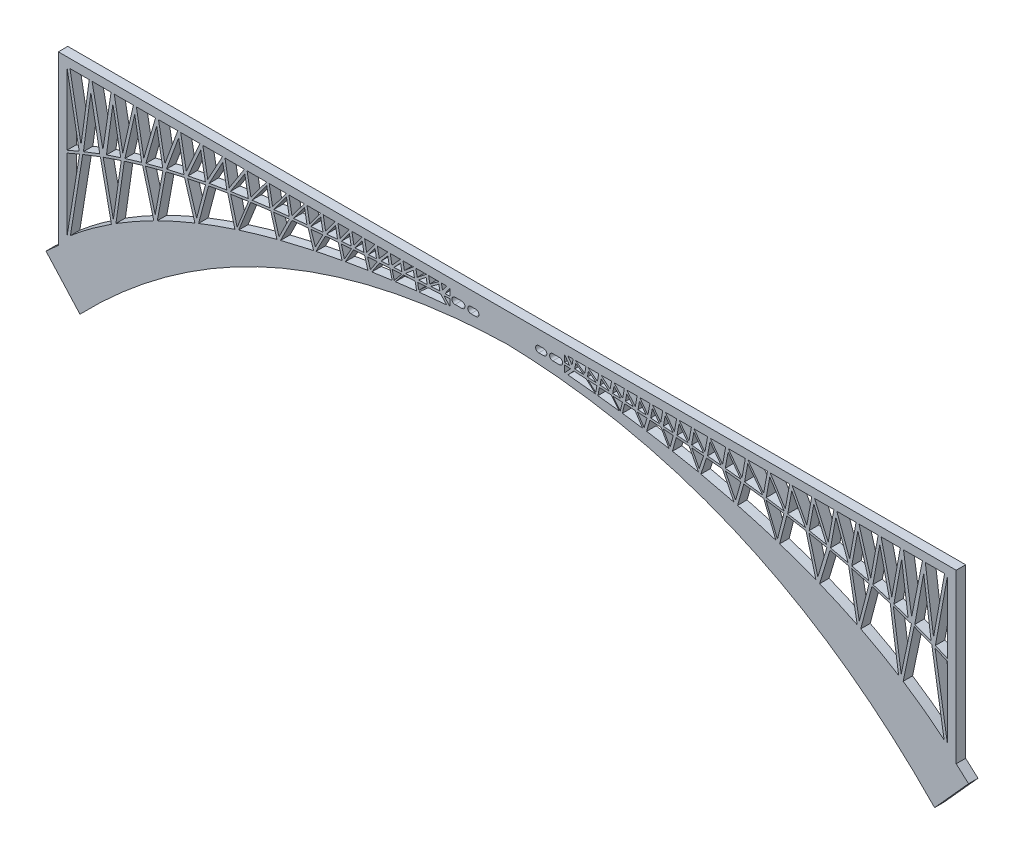
from build123d import *

# Parameters (mm, degrees)
BOSS_EXTRU_1_DEPTH = 820
EXTRU_MINCE6_DEPTH = 820
BOSS_EXTRU_5_DEPTH = 820
BOSS_EXTRU_6_DEPTH = 820


# Read off the part's stored shape, not the designer's step: Extru.-Mince6
with BuildPart() as part:
    # Esquisse2 → Boss.-Extru.1 (new body)
    with BuildSketch(Plane.XY):
        with BuildLine():
            Line((-2.244606432, 13536.155138814), (-2.244606432, 11036.761294931))
            add(Edge.make_bspline(
                [(-37058.069938453, -5233.682093287), (-21887.91411733, 10492.361507123), (-2.244606432, 11036.761294931)],
                knots=[0, 0, 0, 1, 1, 1], degree=2))
            Line((-37058.069938453, -5233.682093287), (-40002.244606432, -1963.844861186))
            Line((-40002.244606432, -1963.844861186), (-38933.428003793, -1001.478069557))
            Line((-38933.428003793, -1001.478069557), (-38933.428003793, 13536.155138814))
            Line((-38933.428003793, 13536.155138814), (-2.244606432, 13536.155138814))
        make_face()
        with BuildLine():
            Line((-3157.812321068, 12302.68810111), (-2729.886154084, 12302.68810111))
            ThreePointArc((-2729.886154084, 12302.68810111), (-2457.297461199, 12030.099408225), (-2729.886154084, 11757.51071534))
            Line((-2729.886154084, 11757.51071534), (-3157.812321068, 11757.51071534))
            ThreePointArc((-3157.812321068, 11757.51071534), (-3430.401013953, 12030.099408225), (-3157.812321068, 12302.68810111))
        make_face(mode=Mode.SUBTRACT)
        with BuildLine():
            Line((-38183.428003793, 12786.155138814), (-4973.994358675, 12786.155138814))
            Line((-4973.994358675, 12786.155138814), (-4973.994358675, 11392.620292854))
            add(Edge.make_bspline(
                [(-4973.994358675, 11392.620292854), (-27306.006645138, 9475.029384523), (-38183.428003793, 0)],
                knots=[0, 0, 0, 1, 1, 1], degree=2))
            Line((-38183.428003793, 0), (-38183.428003793, 12786.155138814))
        make_face(mode=Mode.SUBTRACT)
        with BuildLine():
            Line((-4531.089851617, 12308.04114701), (-3946.776748541, 12308.04114701))
            ThreePointArc((-3946.776748541, 12308.04114701), (-3674.188055656, 12035.452454125), (-3946.776748541, 11762.863761239))
            Line((-3946.776748541, 11762.863761239), (-4531.089851617, 11762.863761239))
            ThreePointArc((-4531.089851617, 11762.863761239), (-4803.678544502, 12035.452454125), (-4531.089851617, 12308.04114701))
        make_face(mode=Mode.SUBTRACT)
    boss_extru_1 = extrude(amount=BOSS_EXTRU_1_DEPTH)

    # Extru.-Mince6 outline → Extru.-Mince6 (add)
    with BuildSketch(Plane.XY):
        with BuildLine():
            Line((-38183.428003793, 6522.511007148), (-38183.428003793, 6303.687196078))
            add(Edge.make_bspline(
                [(-38183.428003793, 6303.687196078), (-36967.661290404, 6844.884291577), (-35735.73188448, 7327.922569493), (-33141.981932269, 8227.751320372), (-31777.813856111, 8635.820478019), (-29023.663743539, 9351.092754748), (-27633.682159885, 9658.295271708), (-24834.23490444, 10190.212405104), (-23424.769754989, 10414.926745323), (-20592.712288631, 10800.259892109), (-19170.120396715, 10960.878633716), (-16318.178696015, 11236.431807199), (-14888.829174365, 11351.366262412), (-12029.74303134, 11553.981118416), (-10600.006574738, 11641.661547035), (-7769.602111438, 11806.86885317), (-6368.838193705, 11884.537074265), (-4973.994358675, 11966.735610338)],
                knots=[0.009502629, 0.009502629, 0.009502629, 0.009502629, 0.125, 0.125, 0.25, 0.25, 0.375, 0.375, 0.5, 0.5, 0.625, 0.625, 0.75, 0.75, 0.875, 0.875, 0.997977053, 0.997977053, 0.997977053, 0.997977053], degree=3))
            Line((-4973.994358675, 11966.735610338), (-4973.994358675, 12167.082703864))
            add(Edge.make_bspline(
                [(-38183.428003793, 6522.511007148), (-36988.607694292, 7051.538460175), (-35778.550369124, 7524.761528352), (-33202.096604982, 8418.589852207), (-31832.809457573, 8828.172458673), (-29069.21545299, 9545.897380996), (-27674.908143053, 9854.040298977), (-24867.676181204, 10387.436588198), (-23454.75100695, 10612.690235655), (-20616.658635699, 10998.844498862), (-19191.49101371, 11159.745179573), (-16335.276736308, 11435.711167269), (-14904.229793763, 11550.77645092), (-12042.618298018, 11753.570271094), (-10612.053580046, 11841.29877979), (-7776.920203959, 12006.78210688), (-6372.260212679, 12084.654958353), (-4973.994358675, 12167.082703864)],
                knots=[0.012065964, 0.012065964, 0.012065964, 0.012065964, 0.125, 0.125, 0.25, 0.25, 0.375, 0.375, 0.5, 0.5, 0.625, 0.625, 0.75, 0.75, 0.875, 0.875, 0.998322947, 0.998322947, 0.998322947, 0.998322947], degree=3))
        make_face()
    extru_mince6 = extrude(amount=EXTRU_MINCE6_DEPTH)

    # Esquisse6 → Boss.-Extru.5 (add)
    with BuildSketch(Plane.XY):
        with BuildLine():
            Line((-38183.428003793, 12786.155138814), (-38183.428003793, 12769.353685746))
            Line((-38183.428003793, 12769.353685746), (-37124.884102272, 6975.155674113))
            add(Edge.make_bspline(
                [(-37124.884102273, 6975.155674113), (-37003.282697839, 7025.346972454), (-36881.532952347, 7074.989155189), (-36759.637336028, 7124.089268105)],
                knots=[0.045294286, 0.045294286, 0.045294286, 0.045294286, 0.056704367, 0.056704367, 0.056704367, 0.056704367], degree=3))
            Line((-36759.637336028, 7124.089268105), (-36111.785997958, 11893.91340386))
            Line((-36111.785997958, 11893.91340386), (-35340.019595981, 7669.46192352))
            add(Edge.make_bspline(
                [(-35340.019595981, 7669.46192352), (-35147.217184046, 7740.031774897), (-34954.079740368, 7809.336350258), (-34760.616782085, 7877.402795117)],
                knots=[0.100799494, 0.100799494, 0.100799494, 0.100799494, 0.118686798, 0.118686798, 0.118686798, 0.118686798], degree=3))
            Line((-34760.616782085, 7877.402795117), (-34201.612185023, 11993.090241262))
            Line((-34201.612185023, 11993.090241262), (-33525.805714906, 8293.898833351))
            add(Edge.make_bspline(
                [(-33525.805714906, 8293.898833351), (-33403.767211736, 8333.328522836), (-33281.608819445, 8372.294894123), (-33159.332859893, 8410.804629723)],
                knots=[0.156610574, 0.156610574, 0.156610574, 0.156610574, 0.167816591, 0.167816591, 0.167816591, 0.167816591], degree=3))
            Line((-33159.332859893, 8410.804629724), (-32309.105384442, 12143.580968361))
            Line((-32309.105384442, 12143.580968361), (-31706.618751713, 8845.723558405))
            add(Edge.make_bspline(
                [(-31706.618751714, 8845.723558405), (-31586.43177328, 8879.886668195), (-31466.141572032, 8913.640081574), (-31345.750305313, 8946.99000756)],
                knots=[0.212031349, 0.212031349, 0.212031349, 0.212031349, 0.222966187, 0.222966187, 0.222966187, 0.222966187], degree=3))
            Line((-31345.750305313, 8946.99000756), (-30404.290511945, 12226.700464355))
            Line((-30404.290511945, 12226.700464355), (-29875.705651478, 9333.362414706))
            add(Edge.make_bspline(
                [(-29875.705651478, 9333.362414706), (-29770.372765024, 9359.595204046), (-29664.970106269, 9385.542151297), (-29559.499082953, 9411.207334525)],
                knots=[0.267326298, 0.267326298, 0.267326298, 0.267326298, 0.276831479, 0.276831479, 0.276831479, 0.276831479], degree=3))
            Line((-29559.499082953, 9411.207334525), (-28497.312055493, 12297.977056308))
            Line((-28497.312055493, 12297.977056308), (-28034.053112546, 9762.2163361))
            add(Edge.make_bspline(
                [(-28034.053112545, 9762.2163361), (-27919.212465415, 9787.167055289), (-27804.299647192, 9811.810613355), (-27689.316443199, 9836.152182171)],
                knots=[0.322518869, 0.322518869, 0.322518869, 0.322518869, 0.332807515, 0.332807515, 0.332807515, 0.332807515], degree=3))
            Line((-27689.316443199, 9836.152182171), (-26585.753726838, 12344.184601649))
            Line((-26585.753726838, 12344.184601649), (-26182.619218078, 10137.529624259))
            add(Edge.make_bspline(
                [(-26182.619218079, 10137.529624259), (-26072.882605514, 10158.238561272), (-25963.089533864, 10178.695509045), (-25853.241525393, 10198.904892772)],
                knots=[0.37763191, 0.37763191, 0.37763191, 0.37763191, 0.387401862, 0.387401862, 0.387401862, 0.387401862], degree=3))
            Line((-25853.241525393, 10198.904892773), (-24670.759235677, 12371.583474121))
            Line((-24670.759235677, 12371.583474121), (-24322.337888694, 10464.414321285))
            add(Edge.make_bspline(
                [(-24322.337888694, 10464.414321285), (-24218.422630744, 10481.377484754), (-24114.46489372, 10498.139210992), (-24010.465949694, 10514.703197883)],
                knots=[0.432687891, 0.432687891, 0.432687891, 0.432687891, 0.441890255, 0.441890255, 0.441890255, 0.441890255], degree=3))
            Line((-24010.465949694, 10514.703197883), (-22765.826798735, 12454.059452474))
            Line((-22765.826798735, 12454.059452474), (-22454.122547538, 10747.870271364))
            add(Edge.make_bspline(
                [(-22454.122547538, 10747.870271364), (-22350.308156095, 10762.477570207), (-22246.459266731, 10776.907472055), (-22142.577131031, 10791.16361524)],
                knots=[0.48770893, 0.48770893, 0.48770893, 0.48770893, 0.496861626, 0.496861626, 0.496861626, 0.496861626], degree=3))
            Line((-22142.577131031, 10791.16361524), (-20858.994414908, 12523.059372165))
            Line((-20858.994414908, 12523.059372165), (-20579.420140887, 10992.741451188))
            add(Edge.make_bspline(
                [(-20579.420140887, 10992.741451188), (-20471.14211549, 11005.843736862), (-20362.834935174, 11018.778003082), (-20254.500002192, 11031.548330129)],
                knots=[0.54270088, 0.54270088, 0.54270088, 0.54270088, 0.552213257, 0.552213257, 0.552213257, 0.552213257], degree=3))
            Line((-20254.500002192, 11031.548330129), (-19150.113829921, 12521.660110022))
            Line((-19150.113829921, 12521.660110022), (-18905.416978224, 11182.252259748))
            add(Edge.make_bspline(
                [(-18905.416978225, 11182.252259748), (-18788.133734029, 11194.657789704), (-18670.824875933, 11206.89166436), (-18553.492173039, 11218.959031455)],
                knots=[0.591659807, 0.591659807, 0.591659807, 0.591659807, 0.601938342, 0.601938342, 0.601938342, 0.601938342], degree=3))
            Line((-18553.492173039, 11218.959031455), (-17584.456839407, 12526.44639596))
            Line((-17584.456839407, 12526.44639596), (-17366.873399692, 11335.450413699))
            add(Edge.make_bspline(
                [(-17366.873399693, 11335.450413698), (-17256.475008752, 11345.791564861), (-17146.060820226, 11356.000971813), (-17035.63230202, 11366.082902755)],
                knots=[0.636566519, 0.636566519, 0.636566519, 0.636566519, 0.646226023, 0.646226023, 0.646226023, 0.646226023], degree=3))
            Line((-17035.63230202, 11366.082902755), (-16178.376018441, 12522.750487541))
            Line((-16178.376018441, 12522.750487541), (-15983.920733348, 11458.352095923))
            add(Edge.make_bspline(
                [(-15983.920733348, 11458.352095923), (-15878.557057037, 11467.234528058), (-15773.184588346, 11476.013383436), (-15667.804599691, 11484.692361836)],
                knots=[0.676880192, 0.676880192, 0.676880192, 0.676880192, 0.686090307, 0.686090307, 0.686090307, 0.686090307], degree=3))
            Line((-15667.804599691, 11484.692361836), (-14898.046652179, 12523.301332191))
            Line((-14898.046652179, 12523.301332191), (-14722.058554191, 11559.987589639))
            add(Edge.make_bspline(
                [(-14722.058554192, 11559.987589639), (-14609.957693259, 11568.616978468), (-14497.852631979, 11577.14593094), (-14385.744900614, 11585.578896572)],
                knots=[0.713637867, 0.713637867, 0.713637867, 0.713637867, 0.723432257, 0.723432257, 0.723432257, 0.723432257], degree=3))
            Line((-14385.744900614, 11585.578896571), (-13694.156977021, 12518.715635922))
            Line((-13694.156977021, 12518.715635922), (-13535.048705507, 11647.797737177))
            add(Edge.make_bspline(
                [(-13535.048705508, 11647.797737176), (-13514.507108864, 11649.259113915), (-13493.965552521, 11650.717646069), (-13386.086166495, 11658.362734454), (-13298.749185179, 11664.501179311), (-13211.413825984, 11670.590797199)],
                knots=[0.748205425, 0.748205425, 0.748205425, 0.748205425, 0.75, 0.75, 0.757630131, 0.757630131, 0.757630131, 0.757630131], degree=3))
            Line((-13211.413825984, 11670.590797199), (-12583.894938261, 12517.281302912))
            Line((-12583.894938261, 12517.281302912), (-12438.832148108, 11723.244769272))
            add(Edge.make_bspline(
                [(-12438.832148109, 11723.244769272), (-12306.894845374, 11732.038501328), (-12174.966120643, 11740.734908939), (-12043.048471569, 11749.341241866)],
                knots=[0.780130997, 0.780130997, 0.780130997, 0.780130997, 0.79165991, 0.79165991, 0.79165991, 0.79165991], degree=3))
            Line((-12043.048471569, 11749.341241866), (-11473.894938261, 12517.281302912))
            Line((-11473.894938261, 12517.281302912), (-11341.811325618, 11794.289460394))
            add(Edge.make_bspline(
                [(-11341.811325619, 11794.289460394), (-11209.792660277, 11802.608634719), (-11077.789531789, 11810.850408842), (-10945.804446233, 11819.022056978)],
                knots=[0.812091509, 0.812091509, 0.812091509, 0.812091509, 0.823633371, 0.823633371, 0.823633371, 0.823633371], degree=3))
            Line((-10945.804446233, 11819.022056978), (-10360.891951327, 12500.843722096))
            Line((-10360.891951326, 12500.843722096), (-10244.154809284, 11861.85452634))
            add(Edge.make_bspline(
                [(-10244.154809284, 11861.85452634), (-10109.940453643, 11869.939039855), (-9975.74937428, 11877.964306837), (-9841.584210721, 11885.937988857)],
                knots=[0.844091409, 0.844091409, 0.844091409, 0.844091409, 0.855834608, 0.855834608, 0.855834608, 0.855834608], degree=3))
            Line((-9841.584210721, 11885.937988857), (-9255.320208822, 12525.082868665))
            Line((-9255.320208822, 12525.082868665), (-9146.032078423, 11926.867653456))
            add(Edge.make_bspline(
                [(-9146.032078423, 11926.867653456), (-9039.074121107, 11933.104963231), (-8932.135562487, 11939.317870157), (-8825.217744578, 11945.510260828)],
                knots=[0.876135199, 0.876135199, 0.876135199, 0.876135199, 0.885503815, 0.885503815, 0.885503815, 0.885503815], degree=3))
            Line((-8825.217744578, 11945.510260828), (-8145.60199258, 12526.625280733))
            Line((-8145.60199258, 12526.625280733), (-8047.613731578, 11990.262654446))
            add(Edge.make_bspline(
                [(-8047.613731578, 11990.262654446), (-7938.838290391, 11996.490963245), (-7830.087736535, 12002.70777072), (-7721.363487511, 12008.91718207)],
                knots=[0.908227445, 0.908227445, 0.908227445, 0.908227445, 0.917768518, 0.917768518, 0.917768518, 0.917768518], degree=3))
            Line((-7721.363487511, 12008.91718207), (-7038.961255908, 12545.01302721))
            Line((-7038.961255908, 12545.01302721), (-6949.071655832, 12052.98039514))
            add(Edge.make_bspline(
                [(-6949.071655833, 12052.98039514), (-6846.750421283, 12058.819945895), (-6744.455523066, 12064.661565095), (-6642.188147036, 12070.508687069)],
                knots=[0.940372794, 0.940372794, 0.940372794, 0.940372794, 0.949362935, 0.949362935, 0.949362935, 0.949362935], degree=3))
            Line((-6642.188147036, 12070.508687069), (-5935.622054877, 12581.472533598))
            Line((-5935.622054877, 12581.472533598), (-5850.579360896, 12115.970623231))
            add(Edge.make_bspline(
                [(-5850.579360896, 12115.970623231), (-5701.102513589, 12124.60460779), (-5551.691196994, 12133.269382928), (-5402.349130351, 12141.97571988)],
                knots=[0.972575967, 0.972575967, 0.972575967, 0.972575967, 0.985735515, 0.985735515, 0.985735515, 0.985735515], degree=3))
            Line((-5402.349130351, 12141.975719879), (-4973.994358675, 12754.975659941))
            Line((-4973.994358675, 12754.975659941), (-4973.994358675, 12786.155138814))
            Line((-4973.994358675, 12786.155138814), (-5265.849118585, 12786.155138814))
            Line((-5265.849118585, 12786.155138814), (-5620.251867309, 12278.984732202))
            Line((-5620.251867309, 12278.984732202), (-5712.906992293, 12786.155138814))
            Line((-5712.906992293, 12786.155138814), (-5917.315332145, 12786.155138814))
            Line((-5917.315332145, 12786.155138814), (-6717.226531225, 12207.687380881))
            Line((-6717.226531225, 12207.687380881), (-6822.906992293, 12786.155138814))
            Line((-6822.906992293, 12786.155138814), (-7020.675026247, 12786.155138814))
            Line((-7020.675026247, 12786.155138814), (-7818.414127048, 12159.450539036))
            Line((-7818.414127048, 12159.450539036), (-7932.906992293, 12786.155138814))
            Line((-7932.906992293, 12786.155138814), (-8138.489738608, 12786.155138814))
            Line((-8138.489738608, 12786.155138814), (-8920.714197632, 12117.30309891))
            Line((-8920.714197632, 12117.30309891), (-9042.906992293, 12786.155138814))
            Line((-9042.906992293, 12786.155138814), (-9261.909264075, 12786.155138814))
            Line((-9261.909264075, 12786.155138814), (-10004.921939923, 11976.122890779))
            Line((-10004.921939923, 11976.122890779), (-10152.906992293, 12786.155138814))
            Line((-10152.906992293, 12786.155138814), (-10359.92156987, 12786.155138814))
            Line((-10359.92156987, 12786.155138814), (-11104.370167462, 11918.365192752))
            Line((-11104.370167462, 11918.365192752), (-11262.906992293, 12786.155138814))
            Line((-11262.906992293, 12786.155138814), (-11487.22742738, 12786.155138814))
            Line((-11487.22742738, 12786.155138814), (-12197.761702634, 11827.45471304))
            Line((-12197.761702634, 11827.45471304), (-12372.906992293, 12786.155138814))
            Line((-12372.906992293, 12786.155138814), (-12597.22742738, 12786.155138814))
            Line((-12597.22742738, 12786.155138814), (-13307.761702634, 11827.45471304))
            Line((-13307.761702634, 11827.45471304), (-13482.906992293, 12786.155138814))
            Line((-13482.906992293, 12786.155138814), (-13708.552512258, 12786.155138814))
            Line((-13708.552512258, 12786.155138814), (-14492.674411977, 11728.165362247))
            Line((-14492.674411977, 11728.165362247), (-14685.958905122, 12786.155138814))
            Line((-14685.958905122, 12786.155138814), (-14915.840844897, 12786.155138814))
            Line((-14915.840844897, 12786.155138814), (-15758.640469433, 11648.993446514))
            Line((-15758.640469433, 11648.993446514), (-15966.38890537, 12786.155138814))
            Line((-15966.38890537, 12786.155138814), (-16195.761956408, 12786.155138814))
            Line((-16195.761956408, 12786.155138814), (-17139.231217857, 11513.163230954))
            Line((-17139.231217857, 11513.163230954), (-17371.794519637, 12786.155138814))
            Line((-17371.794519637, 12786.155138814), (-17604.581974666, 12786.155138814))
            Line((-17604.581974666, 12786.155138814), (-18674.574807161, 11342.449156128))
            Line((-18674.574807161, 11342.449156128), (-18938.325918271, 12786.155138814))
            Line((-18938.325918271, 12786.155138814), (-19166.691642035, 12786.155138814))
            Line((-19166.691642035, 12786.155138814), (-20354.226006085, 11183.854250473))
            Line((-20354.226006085, 11183.854250473), (-20646.950871606, 12786.155138814))
            Line((-20646.950871606, 12786.155138814), (-20876.609280605, 12786.155138814))
            Line((-20876.609280605, 12786.155138814), (-22232.230845763, 10957.059742621))
            Line((-22232.230845763, 10957.059742621), (-22566.388872992, 12786.155138814))
            Line((-22566.388872992, 12786.155138814), (-22826.497466667, 12786.155138814))
            Line((-22826.497466667, 12786.155138814), (-22819.501920458, 12747.863311826))
            Line((-22819.501920458, 12747.863311826), (-24111.585948523, 10734.579992435))
            Line((-24111.585948523, 10734.579992435), (-24486.388872992, 12786.155138814))
            Line((-24486.388872992, 12786.155138814), (-24697.417514486, 12786.155138814))
            Line((-24697.417514486, 12786.155138814), (-25976.900882336, 10435.247955937))
            Line((-25976.900882336, 10435.247955937), (-26406.388872992, 12786.155138814))
            Line((-26406.388872992, 12786.155138814), (-26648.611002774, 12786.155138814))
            Line((-26648.611002774, 12786.155138814), (-27834.156723678, 10091.802512798))
            Line((-27834.156723678, 10091.802512798), (-28326.388872991, 12786.155138814))
            Line((-28326.388872991, 12786.155138814), (-28575.4521951, 12786.155138814))
            Line((-28575.4521951, 12786.155138814), (-29692.008950333, 9751.621530014))
            Line((-29692.008950333, 9751.621530014), (-30246.388872992, 12786.155138814))
            Line((-30246.388872992, 12786.155138814), (-30502.707969759, 12786.155138814))
            Line((-30502.707969759, 12786.155138814), (-31519.3618755, 9244.495187864))
            Line((-31519.3618755, 9244.495187864), (-32166.388872992, 12786.155138814))
            Line((-32166.388872992, 12786.155138814), (-32422.71406794, 12786.155138814))
            Line((-32422.71406794, 12786.155138814), (-33345.916069284, 8732.996794844))
            Line((-33345.916069284, 8732.996794844), (-34086.388872991, 12786.155138814))
            Line((-34086.388872991, 12786.155138814), (-34359.267564554, 12786.155138814))
            Line((-34359.267564554, 12786.155138814), (-35066.122000925, 8108.807316884))
            Line((-35066.122000925, 8108.807316884), (-36008.339378333, 12786.155138814))
            Line((-36008.339378333, 12786.155138814), (-36250.681188803, 12786.155138814))
            Line((-36250.681188803, 12786.155138814), (-36965.249563517, 7525.124899198))
            Line((-36965.249563517, 7525.124899198), (-37926.388872992, 12786.155138814))
            Line((-37926.388872992, 12786.155138814), (-38183.428003793, 12786.155138814))
        make_face()
    boss_extru_5 = extrude(amount=BOSS_EXTRU_5_DEPTH)

    # Esquisse8 → Boss.-Extru.6 (add)
    with BuildSketch(Plane.XY):
        Polygon((-38032.444357209, -644.282519604), (-36791.358889282, 7036.983376251), (-37051.46740994, 7036.788479303), (-38292.500715322, -644.154574664), align=None)
        Polygon((-35409.776461266, 8067.446660218), (-34285.072966412, 2671.241504868), (-33988.642236197, 2792.114564128), (-33173.125391949, 8461.08074231), (-33430.037969931, 8420.430923387), (-34162.30319519, 3330.178251435), (-35149.667867591, 8067.446660218), align=None)
        Polygon((-31754.872172788, 9169.842558087), (-30621.239784285, 4863.941757481), (-30382.533035249, 4961.277195684), (-29541.575107937, 9558.07606812), (-29797.212044874, 9510.052771927), (-30529.910076108, 5505.018305365), (-31494.763579113, 9169.842558087), align=None)
        Polygon((-28034.590712213, 9725.187593484), (-27053.077623383, 6480.076017997), (-26810.538619832, 6578.974102308), (-25872.831092442, 10111.056769915), (-26143.845983101, 10023.576963222), (-26936.735490881, 7036.983376251), (-27749.806956464, 9725.187593484), align=None)
        Polygon((-24264.893887976, 10370.752575993), (-23593.141607152, 7742.395090865), (-23318.91816728, 7913.058163611), (-22170.605219596, 10757.22868255), (-22403.670342216, 10641.986986024), (-23426.64699713, 8108.252563422), (-24004.893887976, 10370.752575993), align=None)
        Polygon((-20520.940251373, 10830.011419506), (-19940.359676439, 8803.036956458), (-19708.694369581, 8912.579004476), (-18599.79482598, 11149.172999197), (-18856.193132344, 11106.046342783), (-19796.677703787, 9209.136783433), (-20260.940251373, 10830.011419506), align=None)
        Polygon((-17362.635319101, 11398.893786426), (-16762.955331182, 9589.899283416), (-16627.473533259, 9653.961329715), (-15697.813149183, 11416.469146027), (-15948.463697847, 11347.372818668), (-16646.719076928, 10023.576963222), (-17102.635319101, 11398.893786426), align=None)
        Polygon((-14712.695522358, 11578.40269634), (-14295.237326785, 10048.220379149), (-14086.301037968, 10132.142522403), (-13225.67275988, 11660.610747649), (-13460.177281442, 11548.327047287), (-14123.229265651, 10370.752575993), (-14452.695522358, 11578.40269634), align=None)
        Polygon((-12412.892539051, 11676.981436865), (-12037.266258773, 10370.752575993), (-11825.936599589, 10479.342674804), (-10989.200572206, 11742.139765487), (-11236.087224843, 11660.610747649), (-11872.142113947, 10700.680450412), (-12152.892539051, 11676.981436865), align=None)
        Polygon((-10197.868861747, 11736.153539094), (-9918.253747673, 10566.549861936), (-9809.474734697, 10757.22868255), (-8868.773488011, 11900.942743374), (-9059.740288032, 11841.514792967), (-9806.114942619, 10934.064962215), (-9997.868861747, 11736.153539094), align=None)
        Polygon((-8019.665471504, 11924.498604137), (-7854.265595735, 11071.663389654), (-7739.094590624, 11071.663389654), (-6668.906486047, 12016.760689316), (-6881.762392657, 11961.151670072), (-7671.511990152, 11263.713333007), (-7799.665471504, 11924.498604137), align=None)
        Polygon((-5850.484291992, 12004.157563009), (-5550.484291992, 12004.157563009), (-4794.433067261, 11191.059586073), (-5094.433067261, 11191.059586073), align=None)
    boss_extru_6 = extrude(amount=BOSS_EXTRU_6_DEPTH)

    # Symétrie1: Boss.-Extru.1, Extru.-Mince6, Boss.-Extru.5, Boss.-Extru.6 across plane
    add(boss_extru_1.mirror(Plane(origin=(-2.244606432, 0, 820), x_dir=(0, 0, 1), z_dir=(1, 0, 0))))
    add(extru_mince6.mirror(Plane(origin=(-2.244606432, 0, 820), x_dir=(0, 0, 1), z_dir=(1, 0, 0))))
    add(boss_extru_5.mirror(Plane(origin=(-2.244606432, 0, 820), x_dir=(0, 0, 1), z_dir=(1, 0, 0))))
    add(boss_extru_6.mirror(Plane(origin=(-2.244606432, 0, 820), x_dir=(0, 0, 1), z_dir=(1, 0, 0))))


solid = part.part
